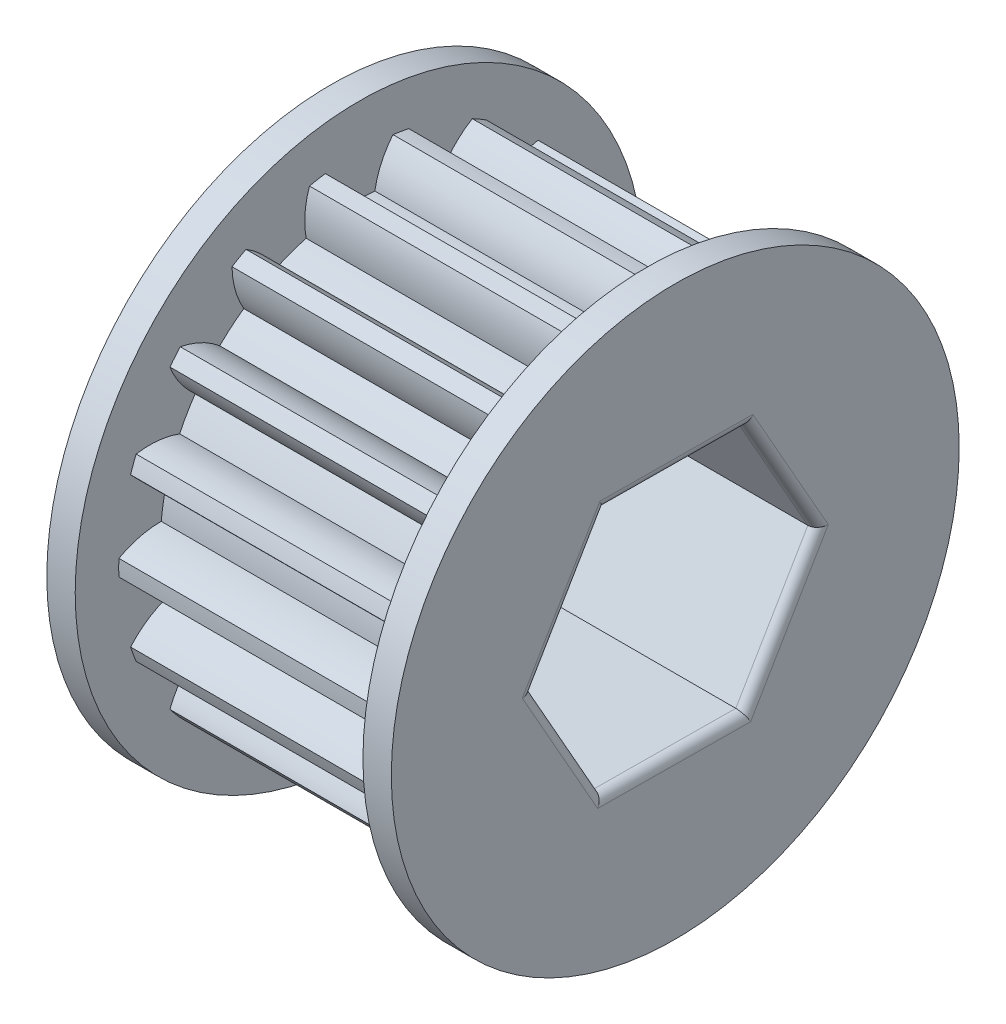
from build123d import *

# Parameters (mm, degrees)
BOSS_EXTRUDE1_START       = -11.2
BOSS_EXTRUDE1_DEPTH       = 15.2
BOSS_EXTRUDE1_START_2     = -11.30300619
BOSS_EXTRUDE1_2_OUTLINE_R = 9.525
BOSS_EXTRUDE1_2_DEPTH     = 0.10300619
BOSS_EXTRUDE1_START_3     = -1.5875
BOSS_EXTRUDE1_3_OUTLINE_R = 9.525
BOSS_EXTRUDE1_3_DEPTH     = 1.39699381
SKETCH2_R                 = 15
SKETCH2_R_2               = 7.854644271
BOSS_EXTRUDE2_DEPTH       = 1.5
SKETCH3_R                 = 15
SKETCH3_R_2               = 9.60106287
BOSS_EXTRUDE3_DEPTH       = 1.5
BOSS_EXTRUDE4_DEPTH       = 1.5
BOSS_EXTRUDE4_DEPTH_BACK  = 16.7
SKETCH5_R                 = 10.503090292
CUT_EXTRUDE1_DEPTH        = 28.950670833
FILLET1_R                 = 0.5
FILLET2_R                 = 0.5


with BuildPart() as part:
    # Boss-Extrude1: read off the stored shape, not the designer's step
    # Boss-Extrude1 outline → Boss-Extrude1 (new body)
    with BuildSketch(Plane(origin=(11.1125, 0, 0), x_dir=(0, 0, -1), z_dir=(1, 0, 0)).offset(BOSS_EXTRUDE1_START)):
        with BuildLine():
            ThreePointArc((12.692845514, 0.426230867), (11.294265748, 0.926615855), (9.809087715, 0.952242218))
            ThreePointArc((9.809087715, 0.952242218), (9.705477367, 1.71133752), (9.543213362, 2.4600906))
            ThreePointArc((9.543213362, 2.4600906), (10.930059468, 2.992132308), (12.073152809, 3.940682842))
            ThreePointArc((12.073152809, 3.940682842), (11.934096284, 4.34365582), (11.781593724, 4.741734842))
            ThreePointArc((11.781593724, 4.741734842), (10.296216892, 4.733600471), (8.891841322, 4.249720572))
            ThreePointArc((8.891841322, 4.249720572), (8.534853559, 4.9276), (8.126286635, 5.575700185))
            ThreePointArc((8.126286635, 5.575700185), (9.247526706, 6.549985156), (9.997259693, 7.832292041))
            ThreePointArc((9.997259693, 7.832292041), (9.728764428, 8.163402643), (9.449307854, 8.485315615))
            ThreePointArc((9.449307854, 8.485315615), (8.056292325, 7.96964301), (6.902107637, 7.034619905))
            ThreePointArc((6.902107637, 7.034619905), (6.334800451, 7.549521196), (5.729209809, 8.01879804))
            ThreePointArc((5.729209809, 8.01879804), (6.449605744, 9.317813127), (6.715549515, 10.779211228))
            ThreePointArc((6.715549515, 10.779211228), (6.35, 10.998522628), (5.977295999, 11.205442095))
            ThreePointArc((5.977295999, 11.205442095), (4.844660004, 10.244428982), (4.079877906, 8.971040258))
            ThreePointArc((4.079877906, 8.971040258), (3.370676917, 9.260858716), (2.641105726, 9.494710506))
            ThreePointArc((2.641105726, 9.494710506), (2.873767144, 10.961775319), (2.623844955, 12.425998457))
            ThreePointArc((2.623844955, 12.425998457), (2.205331856, 12.507058463), (1.784334031, 12.574026883))
            ThreePointArc((1.784334031, 12.574026883), (1.048690187, 11.283585627), (0.765554687, 9.825420757))
            ThreePointArc((0.765554687, 9.825420757), (0, 9.8552), (-0.765554687, 9.825420757))
            ThreePointArc((-0.765554687, 9.825420757), (-1.048690187, 11.283585627), (-1.784334031, 12.574026883))
            ThreePointArc((-1.784334031, 12.574026883), (-2.205331856, 12.507058463), (-2.623844955, 12.425998457))
            ThreePointArc((-2.623844955, 12.425998457), (-2.873767144, 10.961775319), (-2.641105726, 9.494710506))
            ThreePointArc((-2.641105726, 9.494710506), (-3.370676917, 9.260858716), (-4.079877906, 8.971040258))
            ThreePointArc((-4.079877906, 8.971040258), (-4.844660004, 10.244428982), (-5.977295999, 11.205442095))
            ThreePointArc((-5.977295999, 11.205442095), (-6.35, 10.998522628), (-6.715549515, 10.779211228))
            ThreePointArc((-6.715549515, 10.779211228), (-6.449605744, 9.317813127), (-5.729209809, 8.01879804))
            ThreePointArc((-5.729209809, 8.01879804), (-6.334800451, 7.549521196), (-6.902107637, 7.034619905))
            ThreePointArc((-6.902107637, 7.034619905), (-8.056292325, 7.96964301), (-9.449307854, 8.485315615))
            ThreePointArc((-9.449307854, 8.485315615), (-9.728764428, 8.163402643), (-9.997259693, 7.832292041))
            ThreePointArc((-9.997259693, 7.832292041), (-9.247526706, 6.549985156), (-8.126286635, 5.575700185))
            ThreePointArc((-8.126286635, 5.575700185), (-8.534853559, 4.9276), (-8.891841322, 4.249720572))
            ThreePointArc((-8.891841322, 4.249720572), (-10.296216892, 4.733600471), (-11.781593724, 4.741734842))
            ThreePointArc((-11.781593724, 4.741734842), (-11.934096284, 4.34365582), (-12.073152809, 3.940682842))
            ThreePointArc((-12.073152809, 3.940682842), (-10.930059468, 2.992132308), (-9.543213362, 2.4600906))
            ThreePointArc((-9.543213362, 2.4600906), (-9.705477367, 1.71133752), (-9.809087715, 0.952242218))
            ThreePointArc((-9.809087715, 0.952242218), (-11.294265748, 0.926615855), (-12.692845514, 0.426230867))
            ThreePointArc((-12.692845514, 0.426230867), (-12.7, 0), (-12.692845514, -0.426230867))
            ThreePointArc((-12.692845514, -0.426230867), (-11.294265748, -0.926615855), (-9.809087715, -0.952242218))
            ThreePointArc((-9.809087715, -0.952242218), (-9.705477367, -1.71133752), (-9.543213362, -2.4600906))
            ThreePointArc((-9.543213362, -2.4600906), (-10.930059468, -2.992132308), (-12.073152809, -3.940682842))
            ThreePointArc((-12.073152809, -3.940682842), (-11.934096284, -4.34365582), (-11.781593724, -4.741734842))
            ThreePointArc((-11.781593724, -4.741734842), (-10.296216892, -4.733600471), (-8.891841322, -4.249720572))
            ThreePointArc((-8.891841322, -4.249720572), (-8.534853559, -4.9276), (-8.126286635, -5.575700185))
            ThreePointArc((-8.126286635, -5.575700185), (-9.247526706, -6.549985156), (-9.997259693, -7.832292041))
            ThreePointArc((-9.997259693, -7.832292041), (-9.728764428, -8.163402643), (-9.449307854, -8.485315615))
            ThreePointArc((-9.449307854, -8.485315615), (-8.056292325, -7.96964301), (-6.902107637, -7.034619905))
            ThreePointArc((-6.902107637, -7.034619905), (-6.334800451, -7.549521196), (-5.729209809, -8.01879804))
            ThreePointArc((-5.729209809, -8.01879804), (-6.449605744, -9.317813127), (-6.715549515, -10.779211228))
            ThreePointArc((-6.715549515, -10.779211228), (-6.35, -10.998522628), (-5.977295999, -11.205442095))
            ThreePointArc((-5.977295999, -11.205442095), (-4.844660004, -10.244428982), (-4.079877906, -8.971040258))
            ThreePointArc((-4.079877906, -8.971040258), (-3.370676917, -9.260858716), (-2.641105726, -9.494710506))
            ThreePointArc((-2.641105726, -9.494710506), (-2.873767144, -10.961775319), (-2.623844955, -12.425998457))
            ThreePointArc((-2.623844955, -12.425998457), (-2.205331856, -12.507058463), (-1.784334031, -12.574026883))
            ThreePointArc((-1.784334031, -12.574026883), (-1.048690187, -11.283585627), (-0.765554687, -9.825420757))
            ThreePointArc((-0.765554687, -9.825420757), (0, -9.8552), (0.765554687, -9.825420757))
            ThreePointArc((0.765554687, -9.825420757), (1.048690187, -11.283585627), (1.784334031, -12.574026883))
            ThreePointArc((1.784334031, -12.574026883), (2.205331856, -12.507058463), (2.623844955, -12.425998457))
            ThreePointArc((2.623844955, -12.425998457), (2.873767144, -10.961775319), (2.641105726, -9.494710506))
            ThreePointArc((2.641105726, -9.494710506), (3.370676917, -9.260858716), (4.079877906, -8.971040258))
            ThreePointArc((4.079877906, -8.971040258), (4.844660004, -10.244428982), (5.977295999, -11.205442095))
            ThreePointArc((5.977295999, -11.205442095), (6.35, -10.998522628), (6.715549515, -10.779211228))
            ThreePointArc((6.715549515, -10.779211228), (6.449605744, -9.317813127), (5.729209809, -8.01879804))
            ThreePointArc((5.729209809, -8.01879804), (6.334800451, -7.549521196), (6.902107637, -7.034619905))
            ThreePointArc((6.902107637, -7.034619905), (8.056292325, -7.96964301), (9.449307854, -8.485315615))
            ThreePointArc((9.449307854, -8.485315615), (9.728764428, -8.163402643), (9.997259693, -7.832292041))
            ThreePointArc((9.997259693, -7.832292041), (9.247526706, -6.549985156), (8.126286635, -5.575700185))
            ThreePointArc((8.126286635, -5.575700185), (8.534853559, -4.9276), (8.891841322, -4.249720572))
            ThreePointArc((8.891841322, -4.249720572), (10.296216892, -4.733600471), (11.781593724, -4.741734842))
            ThreePointArc((11.781593724, -4.741734842), (11.934096284, -4.34365582), (12.073152809, -3.940682842))
            ThreePointArc((12.073152809, -3.940682842), (10.930059468, -2.992132308), (9.543213362, -2.4600906))
            ThreePointArc((9.543213362, -2.4600906), (9.705477367, -1.71133752), (9.809087715, -0.952242218))
            ThreePointArc((9.809087715, -0.952242218), (11.294265748, -0.926615855), (12.692845514, -0.426230867))
            ThreePointArc((12.692845514, -0.426230867), (12.7, 0), (12.692845514, 0.426230867))
        make_face()
        Polygon((3.666174209, 6.35), (7.332348419, 0), (3.666174209, -6.35), (-3.666174209, -6.35), (-7.332348419, 0), (-3.666174209, 6.35), align=None, mode=Mode.SUBTRACT)
    extrude(amount=BOSS_EXTRUDE1_DEPTH)

    # Boss-Extrude1 2 outline → Boss-Extrude1 2 (add)
    with BuildSketch(Plane(origin=(11.1125, 0, 0), x_dir=(0, 0, -1), z_dir=(1, 0, 0)).offset(BOSS_EXTRUDE1_START_2)):
        Circle(BOSS_EXTRUDE1_2_OUTLINE_R)
        Polygon((3.666174209, 6.35), (7.332348419, 0), (3.666174209, -6.35), (-3.666174209, -6.35), (-7.332348419, 0), (-3.666174209, 6.35), align=None, mode=Mode.SUBTRACT)
    extrude(amount=BOSS_EXTRUDE1_2_DEPTH)

    # Boss-Extrude1 3 outline → Boss-Extrude1 3 (add)
    with BuildSketch(Plane.YZ.offset(BOSS_EXTRUDE1_START_3)):
        Circle(BOSS_EXTRUDE1_3_OUTLINE_R)
        Polygon((6.35, -3.666174209), (0, -7.332348419), (-6.35, -3.666174209), (-6.35, 3.666174209), (0, 7.332348419), (6.35, 3.666174209), align=None, mode=Mode.SUBTRACT)
    extrude(amount=BOSS_EXTRUDE1_3_DEPTH)

    # Boss-Extrude1 4 outline → Boss-Extrude1 4 (revolve, cut)
    with BuildSketch(Plane.YX):
        Polygon((7.747, -1.5875), (6.34964944, -0.19014944), (6.34964944, -1.5875), align=None)
    revolve(axis=Axis((0, 0, 0), (1, 0, 0)), mode=Mode.SUBTRACT)

    # Sketch2 → Boss-Extrude2 (add)
    with BuildSketch(Plane(origin=(15.1125, 0, 0), x_dir=(0, 0, -1), z_dir=(1, 0, 0))):
        Circle(SKETCH2_R)
        Circle(SKETCH2_R_2, mode=Mode.SUBTRACT)
    extrude(amount=BOSS_EXTRUDE2_DEPTH)

    # Sketch3 → Boss-Extrude3 (add)
    with BuildSketch(Plane.ZY.offset(1.5875)):
        with Locations(Location((0, 0, 0), (0, 0, 180))):
            Circle(SKETCH3_R)
        Circle(SKETCH3_R_2, mode=Mode.SUBTRACT)
    extrude(amount=-BOSS_EXTRUDE3_DEPTH)

    # Sketch5 → Boss-Extrude4 (add, two sides: drawn at the far end of the back side and taken through both)
    with BuildSketch(Plane(origin=(15.1125, 0, 0), x_dir=(0, 0, -1), z_dir=(1, 0, 0)).offset(-BOSS_EXTRUDE4_DEPTH_BACK)):
        Circle(SKETCH5_R)
    extrude(amount=BOSS_EXTRUDE4_DEPTH + BOSS_EXTRUDE4_DEPTH_BACK)

    # Sketch4 → Cut-Extrude1 (cut, through all)
    with BuildSketch(Plane(origin=(16.6125, 0, 0), x_dir=(0, 0, -1), z_dir=(1, 0, 0))):
        Polygon((3.697448436, -6.531631373), (7.505282915, -0.063731412), (3.807834479, 6.467899962), (-3.697448436, 6.531631373), (-7.505282915, 0.063731412), (-3.807834479, -6.467899962), align=None)
    extrude(amount=-CUT_EXTRUDE1_DEPTH, mode=Mode.SUBTRACT)

    # Fillet1
    fillet1_edges = [part.edges().sort_by_distance(p)[0] for p in [
        (16.6125, -6.499765667, 0.055193021),
        (16.6125, -3.297681392, -5.601365676),
        (16.6125, 3.202084275, -5.656558697),
        (16.6125, 6.499765667, -0.055193021),
        (16.6125, 3.297681392, 5.601365676),
        (16.6125, -3.202084275, 5.656558697),
    ]]
    fillet(fillet1_edges, radius=FILLET1_R)

    # Fillet2
    fillet2_edges = [part.edges().sort_by_distance(p)[0] for p in [
        (-1.5875, -6.499765667, 0.055193021),
        (-1.5875, -3.202084275, 5.656558697),
        (-1.5875, 3.297681392, 5.601365676),
        (-1.5875, 6.499765667, -0.055193021),
        (-1.5875, 3.202084275, -5.656558697),
        (-1.5875, -3.297681392, -5.601365676),
    ]]
    fillet(fillet2_edges, radius=FILLET2_R)


solid = part.part
